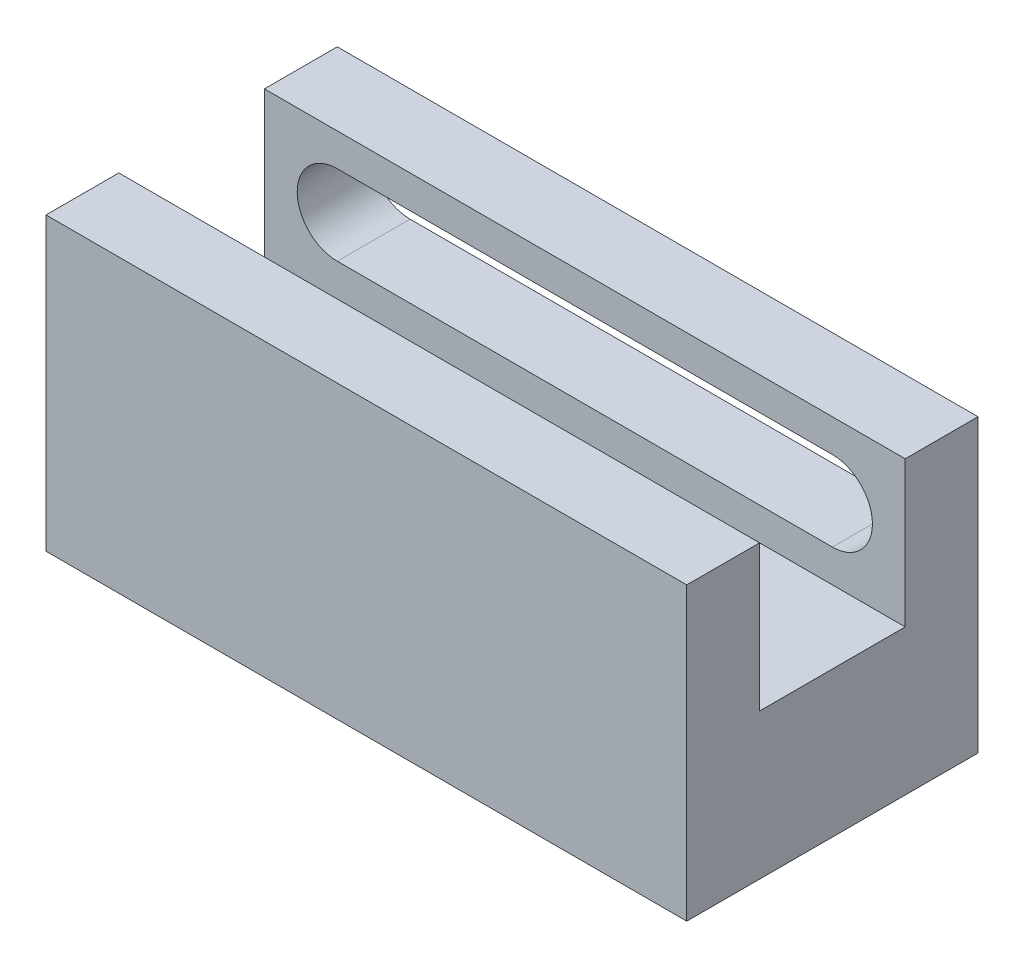
from build123d import *

# Parameters (mm, degrees)
SKETCH1_W               = 44
SKETCH1_H               = 20
SKETCH1_R               = 2.55
BOSS_EXTRUDE1_DEPTH     = 7.5
SKETCH2_W               = 44
SKETCH2_H               = 20
BOSS_EXTRUDE2_DEPTH     = 2.5
SKETCH3_W               = 44
SKETCH3_H               = 5
BOSS_EXTRUDE3_DEPTH     = 10
CUT_EXTRUDE1_DEPTH      = 53.306787322
CUT_EXTRUDE1_DEPTH_BACK = 5


with BuildPart() as part:
    # Sketch1 → Boss-Extrude1 (new body)
    with BuildSketch(Plane(origin=(0, 0, 0), x_dir=(1, 0, 0), z_dir=(0, 1, 0))):
        with Locations((22, 10)):
            Rectangle(SKETCH1_W, SKETCH1_H)
        with Locations((22, 10)):
            Circle(SKETCH1_R, mode=Mode.SUBTRACT)
    extrude(amount=BOSS_EXTRUDE1_DEPTH)

    # Sketch2 → Boss-Extrude2 (add)
    with BuildSketch(Plane(origin=(0, 7.5, 0), x_dir=(1, 0, 0), z_dir=(0, 1, 0))):
        with Locations((22, 10)):
            Rectangle(SKETCH2_W, SKETCH2_H)
    extrude(amount=BOSS_EXTRUDE2_DEPTH)

    # Sketch3 → Boss-Extrude3 (add)
    with BuildSketch(Plane(origin=(0, 10, 0), x_dir=(1, 0, 0), z_dir=(0, 1, 0))):
        with Locations((22, 2.5)):
            Rectangle(SKETCH3_W, SKETCH3_H)
        with Locations((22, 17.5)):
            Rectangle(SKETCH3_W, SKETCH3_H)
    extrude(amount=BOSS_EXTRUDE3_DEPTH)

    # Sketch4 → Cut-Extrude1 (cut, two sides: drawn at the far end of the back side and taken through both)
    with BuildSketch(Plane(origin=(0, 0, -20), x_dir=(-1, 0, 0), z_dir=(0, 0, -1)).offset(-CUT_EXTRUDE1_DEPTH_BACK)):
        with BuildLine():
            Line((-5, 17.75), (-39, 17.75))
            ThreePointArc((-39, 17.75), (-41.75, 15), (-39, 12.25))
            Line((-39, 12.25), (-5, 12.25))
            ThreePointArc((-5, 12.25), (-2.25, 15), (-5, 17.75))
        make_face()
    extrude(amount=CUT_EXTRUDE1_DEPTH + CUT_EXTRUDE1_DEPTH_BACK, mode=Mode.SUBTRACT)


solid = part.part
